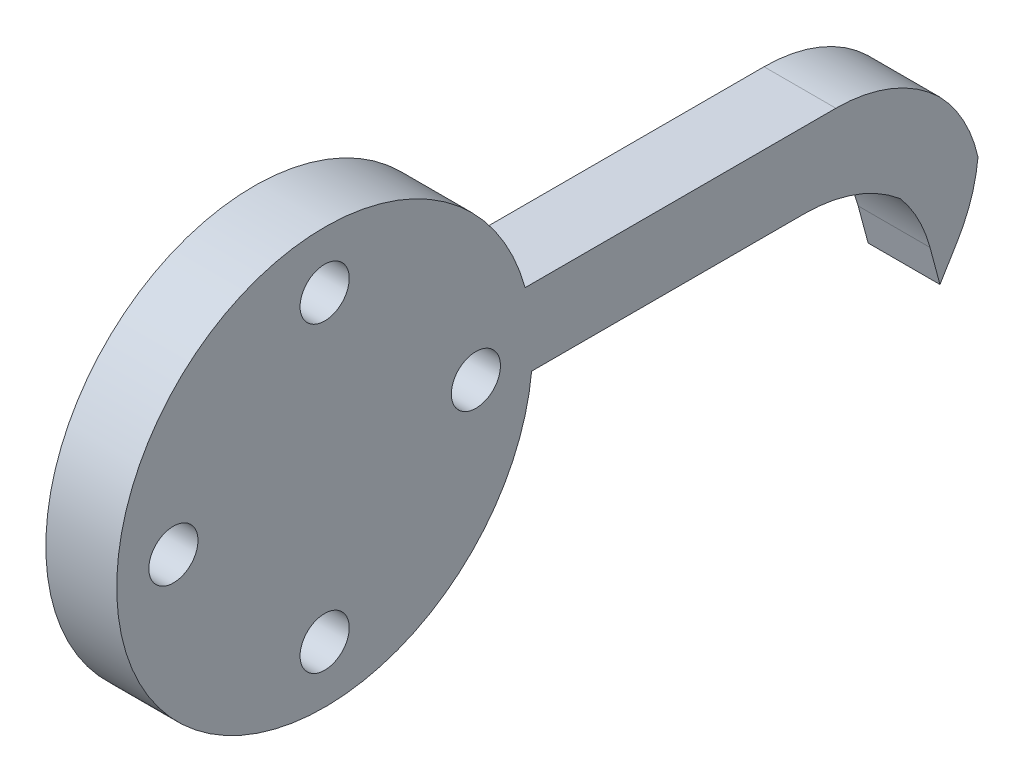
from build123d import *

# Parameters (mm, degrees)
SKETCH1_R           = 13.97
SKETCH1_R_2         = 1.651
BOSS_EXTRUDE1_DEPTH = 4.7625
LEG1_DEPTH          = 4.826
FILLET2_R           = 10


with BuildPart() as part:
    # Sketch1 → Boss-Extrude1 (new body)
    with BuildSketch(Plane(origin=(0, 0, 0), x_dir=(0, 0, -1), z_dir=(1, 0, 0))):
        with Locations(Location((0, 0, 0), (0, 0, 180))):
            Circle(SKETCH1_R)
        with Locations(Location((-10.16, 0, 0), (0, 0, 180))):
            Circle(SKETCH1_R_2, mode=Mode.SUBTRACT)
        with Locations(Location((0, 10.16, 0), (0, 0, 180))):
            Circle(SKETCH1_R_2, mode=Mode.SUBTRACT)
        with Locations(Location((10.16, 0, 0), (0, 0, 180))):
            Circle(SKETCH1_R_2, mode=Mode.SUBTRACT)
        with Locations(Location((0, -10.16, 0), (0, 0, 180))):
            Circle(SKETCH1_R_2, mode=Mode.SUBTRACT)
    extrude(amount=BOSS_EXTRUDE1_DEPTH)

    # Sketch2 → leg1 (add)
    with BuildSketch(Plane(origin=(4.7625, 0, 0), x_dir=(0, 0, -1), z_dir=(1, 0, 0))):
        Polygon((13.467260192, 3.714000931), (38.486260192, 3.714000931), (43.874413865, -1.674152741), (44.112587658, -5.484152741), (41.335339641, -10.038101517), (39.974157744, -4.958101517), (36.382055295, -1.365999069), (13.903055295, -1.365999069), (12.45646463, -1.365999069), (12.45646463, 3.714000931), align=None)
    extrude(amount=-LEG1_DEPTH)

    # Fillet2
    # the kernel refuses this fillet: 10 mm, written as the material it adds along each edge
    with BuildSketch(Plane(origin=(4.7625, -4.958101517, -39.974157744), x_dir=(0, 0.7071067811865493, 0.7071067811865457), z_dir=(-1, 0, 0))) as fillet2_piece_1:
        with BuildLine():
            CenterArc((FILLET2_R * 0.267949192431, -FILLET2_R), FILLET2_R, 90, 30)
            Line((-FILLET2_R * 0.232050807569, -FILLET2_R * 0.133974596216), (0, 0))
            Line((0, 0), (FILLET2_R * 0.267949192431, 0))
        make_face()
    extrude(amount=4.826)
    with BuildSketch(Plane(origin=(4.7625, -1.365999069, -36.382055295), x_dir=(0, 0, 1), z_dir=(-1, 0, 0))) as fillet2_piece_2:
        with BuildLine():
            CenterArc((FILLET2_R * 0.414213562373, -FILLET2_R), FILLET2_R, 90, 45)
            Line((-FILLET2_R * 0.292893218813, -FILLET2_R * 0.292893218813), (0, 0))
            Line((0, 0), (FILLET2_R * 0.414213562373, 0))
        make_face()
    extrude(amount=4.826)
    # the kernel refuses this fillet: 10 mm, written as the material it takes off along each edge
    with BuildSketch(Plane(origin=(15.117839059, 3.714000931, -38.486260192), x_dir=(0, 0, 1), z_dir=(-1, 0, 0))) as fillet2_2_piece_1:
        with BuildLine():
            CenterArc((FILLET2_R * 0.414213562373, -FILLET2_R), FILLET2_R, 90, 45)
            Line((-FILLET2_R * 0.292893218813, -FILLET2_R * 0.292893218813), (0, 0))
            Line((0, 0), (FILLET2_R * 0.414213562373, 0))
        make_face()
    extrude(amount=25.536678119, mode=Mode.SUBTRACT)
    with BuildSketch(Plane(origin=(14.214931239, -1.674152741, -43.874413865), x_dir=(0, 0.707106781186548, 0.707106781186547), z_dir=(-1, 0, 0))) as fillet2_2_piece_2:
        with BuildLine():
            CenterArc((FILLET2_R * 0.378097249561, -FILLET2_R), FILLET2_R, 90, 41.422934713)
            Line((-FILLET2_R * 0.283514821921, -FILLET2_R * 0.250153704503), (0, 0))
            Line((0, 0), (FILLET2_R * 0.378097249561, 0))
        make_face()
    extrude(amount=23.730862478, mode=Mode.SUBTRACT)
    with BuildSketch(Plane(origin=(12.633985106, -5.484152741, -44.112587658), x_dir=(0, -0.853758675625452, 0.5206689195585562), z_dir=(-1, 0, 0))) as fillet2_2_piece_3:
        with BuildLine():
            CenterArc((FILLET2_R * 0.314859404258, FILLET2_R), FILLET2_R, 235.045802712, 34.954197288)
            Line((-FILLET2_R * 0.258062012092, FILLET2_R * 0.180389695839), (0, 0))
            Line((0, 0), (FILLET2_R * 0.314859404258, 0))
        make_face()
    extrude(amount=20.568970213, mode=Mode.SUBTRACT)


solid = part.part
